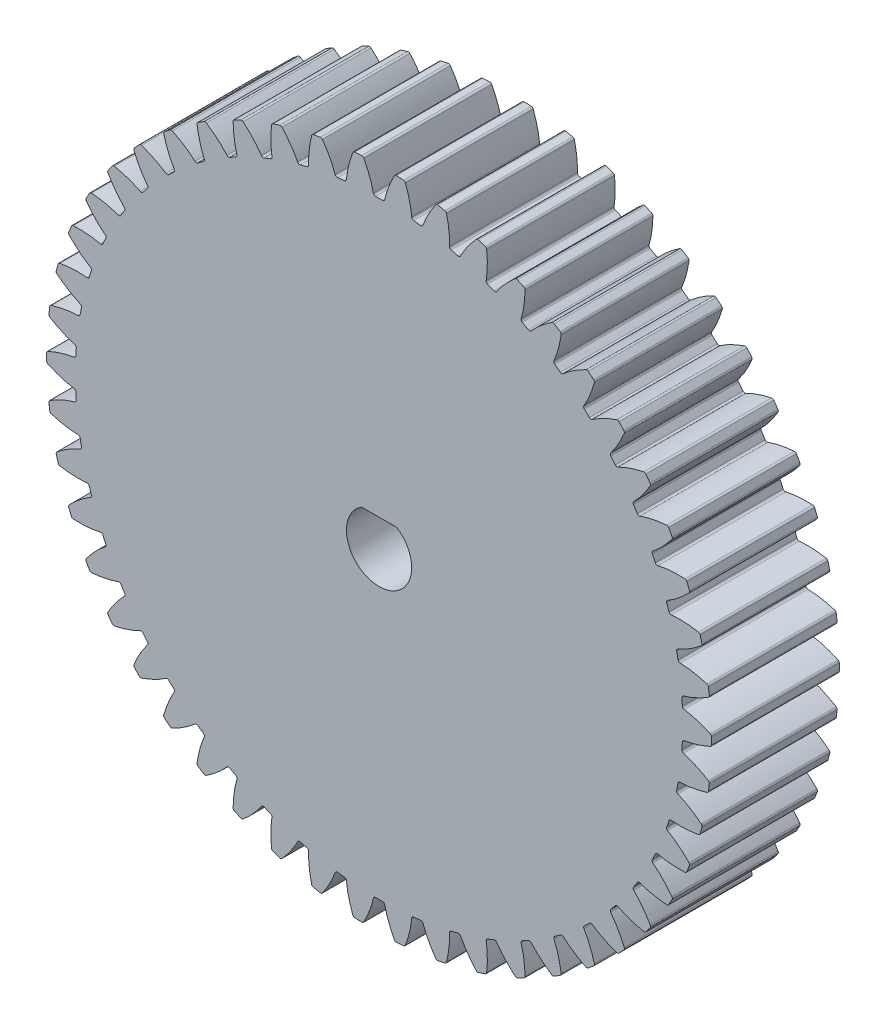
from build123d import *

# Parameters (mm, degrees)
SKETCH1_R                                = 26
BOSS_EXTRUDE1_DEPTH                      = 10
CUT_EXTRUDE_DCGTBC_DEPTH                 = 39.105117767
FILLET_TIP_DCGTBC_R                      = 0.167752518
CIRPATTERN_DCGTBC_COUNT                  = 50
FILLET_TIP_DCGTBC_OF_CIRPATTERN_DCGTBC_R = 0.167752518
CUT_EXTRUDE1_DEPTH                       = 39.081257776
CUT_EXTRUDE1_DEPTH_BACK                  = 39.081257776


with BuildPart() as part:
    # Sketch1 → Boss-Extrude1 (new body)
    with BuildSketch(Plane.XY):
        Circle(SKETCH1_R)
    extrude(amount=BOSS_EXTRUDE1_DEPTH)

    # DCGTBC → Cut-Extrude-DCGTBC (cut, through all)
    with BuildSketch(Plane.XY):
        with BuildLine():
            add(Edge.make_bspline(
                [(0.417725427, 23.746326147), (0.418076366, 23.748433493), (0.421710378, 23.770146189), (0.428969855, 23.811407216), (0.440569886, 23.872095787), (0.456933037, 23.949897096), (0.474635834, 24.027451312), (0.493515344, 24.104653171), (0.517856385, 24.198099905), (0.549089819, 24.310051148), (0.588580624, 24.440745712), (0.636891572, 24.588774691), (0.689899356, 24.739415111), (0.745158194, 24.887453315), (0.80455742, 25.036791245), (0.864556814, 25.181116348), (0.930537507, 25.330771231), (0.993301174, 25.468780409), (1.067674289, 25.62310468), (1.128877101, 25.747559728), (1.195484586, 25.87586559), (1.228402606, 25.938274912), (1.245436376, 25.970153797)],
                knots=[0.089169482, 0.089169482, 0.089169482, 0.089169482, 0.089169482, 0.092110526, 0.119476176, 0.146842496, 0.174208854, 0.201574956, 0.228941013, 0.256307345, 0.307035032, 0.361767352, 0.416499661, 0.471231937, 0.525964282, 0.580696616, 0.635428982, 0.690161387, 0.744893688, 0.799626082, 0.854358407, 0.909090914, 0.909090914, 0.909090914, 0.909090914, 0.909090914], degree=4))
            ThreePointArc((1.245436376, 25.970153797), (0, 26), (-1.245436376, 25.970153797))
            add(Edge.make_bspline(
                [(-0.417725427, 23.746326147), (-0.418076366, 23.748433493), (-0.421710378, 23.770146189), (-0.428969855, 23.811407216), (-0.440569886, 23.872095787), (-0.456933037, 23.949897096), (-0.474635834, 24.027451312), (-0.493515344, 24.104653171), (-0.517856385, 24.198099905), (-0.549089819, 24.310051148), (-0.588580624, 24.440745712), (-0.636891572, 24.588774691), (-0.689899356, 24.739415111), (-0.745158194, 24.887453315), (-0.80455742, 25.036791245), (-0.864556814, 25.181116348), (-0.930537507, 25.330771231), (-0.993301174, 25.468780409), (-1.067674289, 25.62310468), (-1.128877101, 25.747559728), (-1.195484586, 25.87586559), (-1.228402606, 25.938274912), (-1.245436376, 25.970153797)],
                knots=[0.089169482, 0.089169482, 0.089169482, 0.089169482, 0.089169482, 0.092110526, 0.119476176, 0.146842496, 0.174208854, 0.201574956, 0.228941013, 0.256307345, 0.307035032, 0.361767352, 0.416499661, 0.471231937, 0.525964282, 0.580696616, 0.635428982, 0.690161387, 0.744893688, 0.799626082, 0.854358407, 0.909090914, 0.909090914, 0.909090914, 0.909090914, 0.909090914], degree=4))
            ThreePointArc((-0.417725427, 23.746326147), (0, 23.75), (0.417725427, 23.746326147))
        make_face()
    cut_extrude_dcgtbc = extrude(amount=CUT_EXTRUDE_DCGTBC_DEPTH, mode=Mode.SUBTRACT)

    # Fillet-Tip-DCGTBC
    fillet_tip_dcgtbc_edges = [part.edges().sort_by_distance(p)[0] for p in [
        (1.245436376, 25.970153797, 5),
        (-1.245436376, 25.970153797, 5),
        (0.417725427, 23.746326147, 5),
        (-0.417725427, 23.746326147, 5),
    ]]
    fillet(fillet_tip_dcgtbc_edges, radius=FILLET_TIP_DCGTBC_R)

    # CirPattern-DCGTBC: Cut-Extrude-DCGTBC ×50 about axis
    cirpattern_dcgtbc_axis = Axis((0, 0, 10), (0, 0, 1))
    for i in range(1, CIRPATTERN_DCGTBC_COUNT):
        add(cut_extrude_dcgtbc.rotate(cirpattern_dcgtbc_axis, i * 360 / CIRPATTERN_DCGTBC_COUNT), mode=Mode.SUBTRACT)

    # Fillet-Tip-DCGTBC of CirPattern-DCGTBC
    fillet_tip_dcgtbc_of_cirpattern_dcgtbc_edges = [part.edges().sort_by_distance(p)[0] for p in [
        (-2.019307613, 25.921465946, 5),
        (-4.49053909, 25.609276809, 5),
        (-2.561772304, 23.611434151, 5),
        (-3.390635378, 23.506724394, 5),
        (-5.252205915, 25.463981091, 5),
        (-7.66482332, 24.844526228, 5),
        (-5.500869356, 23.104175734, 5),
        (-6.310072985, 22.896407555, 5),
        (-8.402273792, 24.604914044, 5),
        (-10.718228707, 23.687962626, 5),
        (-8.353214411, 22.232550663, 5),
        (-9.12999697, 21.925000692, 5),
        (-11.419832792, 23.357812804, 5),
        (-13.602601225, 22.157825704, 5),
        (-11.073824286, 21.010304988, 5),
        (-11.80593545, 20.60782347, 5),
        (-14.257294208, 21.742344903, 5),
        (-16.272452596, 20.278246633, 5),
        (-13.619793336, 19.456714252, 5),
        (-14.295687275, 18.965648561, 5),
        (-16.869909576, 19.783987234, 5),
        (-18.685677668, 18.0788675, 5),
        (-15.950970109, 17.59627951, 5),
        (-16.559987571, 17.024374045, 5),
        (-19.216476393, 17.513624269, 5),
        (-20.804218441, 15.594373826, 5),
        (-18.030590555, 15.458340928, 5),
        (-18.563126972, 14.814614981, 5),
        (-21.259987898, 14.967060986, 5),
        (-22.594664262, 12.863947562, 5),
        (-19.825857817, 13.076615075, 5),
        (-20.27351477, 12.371220589, 5),
        (-22.968216694, 12.184458211, 5),
        (-24.02877873, 9.93064916, 5),
        (-21.308459458, 10.488663191, 5),
        (-21.664177131, 9.732724657, 5),
        (-24.314222992, 9.209699251, 5),
        (-25.083945003, 6.840738488, 5),
        (-22.455013964, 7.735298823, 5),
        (-22.713182476, 6.940737844, 5),
        (-25.276779469, 6.089697833, 5),
        (-25.74352248, 3.642945284, 5),
        (-23.247439486, 4.859944171, 5),
        (-23.403987365, 4.039291449, 5),
        (-25.840706034, 2.873658241, 5),
        (-25.997109228, 0.387700657, 5),
        (-23.673239, 1.907945297, 5),
        (-23.725697393, 1.074143014, 5),
        (-25.997109228, -0.387700657, 5),
        (-25.840706034, -2.873658241, 5),
        (-23.725697393, -1.074143014, 5),
        (-23.673239, -1.907945297, 5),
        (-25.74352248, -3.642945284, 5),
        (-25.276779469, -6.089697833, 5),
        (-23.403987365, -4.039291449, 5),
        (-23.247439486, -4.859944171, 5),
        (-25.083945003, -6.840738488, 5),
        (-24.314222992, -9.209699251, 5),
        (-22.713182476, -6.940737844, 5),
        (-22.455013964, -7.735298823, 5),
        (-24.02877873, -9.93064916, 5),
        (-22.968216694, -12.184458211, 5),
        (-21.664177131, -9.732724657, 5),
        (-21.308459458, -10.488663191, 5),
        (-22.594664262, -12.863947562, 5),
        (-21.259987898, -14.967060986, 5),
        (-20.27351477, -12.371220589, 5),
        (-19.825857817, -13.076615075, 5),
        (-20.804218441, -15.594373826, 5),
        (-19.216476393, -17.513624269, 5),
        (-18.563126972, -14.814614981, 5),
        (-18.030590555, -15.458340928, 5),
        (-18.685677668, -18.0788675, 5),
        (-16.869909576, -19.783987234, 5),
        (-16.559987571, -17.024374045, 5),
        (-15.950970109, -17.59627951, 5),
        (-16.272452596, -20.278246633, 5),
        (-14.257294208, -21.742344903, 5),
        (-14.295687275, -18.965648561, 5),
        (-13.619793336, -19.456714252, 5),
        (-13.602601225, -22.157825704, 5),
        (-11.419832792, -23.357812804, 5),
        (-11.80593545, -20.60782347, 5),
        (-11.073824286, -21.010304988, 5),
        (-10.718228707, -23.687962626, 5),
        (-8.402273792, -24.604914044, 5),
        (-9.12999697, -21.925000692, 5),
        (-8.353214411, -22.232550663, 5),
        (-7.66482332, -24.844526228, 5),
        (-5.252205915, -25.463981091, 5),
        (-6.310072985, -22.896407555, 5),
        (-5.500869356, -23.104175734, 5),
        (-4.49053909, -25.609276809, 5),
        (-2.019307613, -25.921465946, 5),
        (-3.390635378, -23.506724394, 5),
        (-2.561772304, -23.611434151, 5),
        (-1.245436376, -25.970153797, 5),
        (1.245436376, -25.970153797, 5),
        (-0.417725427, -23.746326147, 5),
        (0.417725427, -23.746326147, 5),
        (2.019307613, -25.921465946, 5),
        (4.49053909, -25.609276809, 5),
        (2.561772304, -23.611434151, 5),
        (3.390635378, -23.506724394, 5),
        (5.252205915, -25.463981091, 5),
        (7.66482332, -24.844526228, 5),
        (5.500869356, -23.104175734, 5),
        (6.310072985, -22.896407555, 5),
        (8.402273792, -24.604914044, 5),
        (10.718228707, -23.687962626, 5),
        (8.353214411, -22.232550663, 5),
        (9.12999697, -21.925000692, 5),
        (11.419832792, -23.357812804, 5),
        (13.602601225, -22.157825704, 5),
        (11.073824286, -21.010304988, 5),
        (11.80593545, -20.60782347, 5),
        (14.257294208, -21.742344903, 5),
        (16.272452596, -20.278246633, 5),
        (13.619793336, -19.456714252, 5),
        (14.295687275, -18.965648561, 5),
        (16.869909576, -19.783987234, 5),
        (18.685677668, -18.0788675, 5),
        (15.950970109, -17.59627951, 5),
        (16.559987571, -17.024374045, 5),
        (19.216476393, -17.513624269, 5),
        (20.804218441, -15.594373826, 5),
        (18.030590555, -15.458340928, 5),
        (18.563126972, -14.814614981, 5),
        (21.259987898, -14.967060986, 5),
        (22.594664262, -12.863947562, 5),
        (19.825857817, -13.076615075, 5),
        (20.27351477, -12.371220589, 5),
        (22.968216694, -12.184458211, 5),
        (24.02877873, -9.93064916, 5),
        (21.308459458, -10.488663191, 5),
        (21.664177131, -9.732724657, 5),
        (24.314222992, -9.209699251, 5),
        (25.083945003, -6.840738488, 5),
        (22.455013964, -7.735298823, 5),
        (22.713182476, -6.940737844, 5),
        (25.276779469, -6.089697833, 5),
        (25.74352248, -3.642945284, 5),
        (23.247439486, -4.859944171, 5),
        (23.403987365, -4.039291449, 5),
        (25.840706034, -2.873658241, 5),
        (25.997109228, -0.387700657, 5),
        (23.673239, -1.907945297, 5),
        (23.725697393, -1.074143014, 5),
        (25.997109228, 0.387700657, 5),
        (25.840706034, 2.873658241, 5),
        (23.725697393, 1.074143014, 5),
        (23.673239, 1.907945297, 5),
        (25.74352248, 3.642945284, 5),
        (25.276779469, 6.089697833, 5),
        (23.403987365, 4.039291449, 5),
        (23.247439486, 4.859944171, 5),
        (25.083945003, 6.840738488, 5),
        (24.314222992, 9.209699251, 5),
        (22.713182476, 6.940737844, 5),
        (22.455013964, 7.735298823, 5),
        (24.02877873, 9.93064916, 5),
        (22.968216694, 12.184458211, 5),
        (21.664177131, 9.732724657, 5),
        (21.308459458, 10.488663191, 5),
        (22.594664262, 12.863947562, 5),
        (21.259987898, 14.967060986, 5),
        (20.27351477, 12.371220589, 5),
        (19.825857817, 13.076615075, 5),
        (20.804218441, 15.594373826, 5),
        (19.216476393, 17.513624269, 5),
        (18.563126972, 14.814614981, 5),
        (18.030590555, 15.458340928, 5),
        (18.685677668, 18.0788675, 5),
        (16.869909576, 19.783987234, 5),
        (16.559987571, 17.024374045, 5),
        (15.950970109, 17.59627951, 5),
        (16.272452596, 20.278246633, 5),
        (14.257294208, 21.742344903, 5),
        (14.295687275, 18.965648561, 5),
        (13.619793336, 19.456714252, 5),
        (13.602601225, 22.157825704, 5),
        (11.419832792, 23.357812804, 5),
        (11.80593545, 20.60782347, 5),
        (11.073824286, 21.010304988, 5),
        (10.718228707, 23.687962626, 5),
        (8.402273792, 24.604914044, 5),
        (9.12999697, 21.925000692, 5),
        (8.353214411, 22.232550663, 5),
        (7.66482332, 24.844526228, 5),
        (5.252205915, 25.463981091, 5),
        (6.310072985, 22.896407555, 5),
        (5.500869356, 23.104175734, 5),
        (4.49053909, 25.609276809, 5),
        (2.019307613, 25.921465946, 5),
        (3.390635378, 23.506724394, 5),
        (2.561772304, 23.611434151, 5),
    ]]
    fillet(fillet_tip_dcgtbc_of_cirpattern_dcgtbc_edges, radius=FILLET_TIP_DCGTBC_OF_CIRPATTERN_DCGTBC_R)

    # Sketch6 → Cut-Extrude1 (cut, two sides: drawn at the far end of the back side and taken through both)
    with BuildSketch(Plane(origin=(0, 0, 0), x_dir=(-1, 0, 0), z_dir=(0, 0, -1)).offset(-CUT_EXTRUDE1_DEPTH_BACK)):
        with BuildLine():
            Line((-1.37113086, 2.150000038), (1.37113086, 2.150000038))
            ThreePointArc((1.37113086, 2.150000038), (0, -2.55), (-1.37113086, 2.150000038))
        make_face()
    extrude(amount=CUT_EXTRUDE1_DEPTH + CUT_EXTRUDE1_DEPTH_BACK, mode=Mode.SUBTRACT)


solid = part.part
